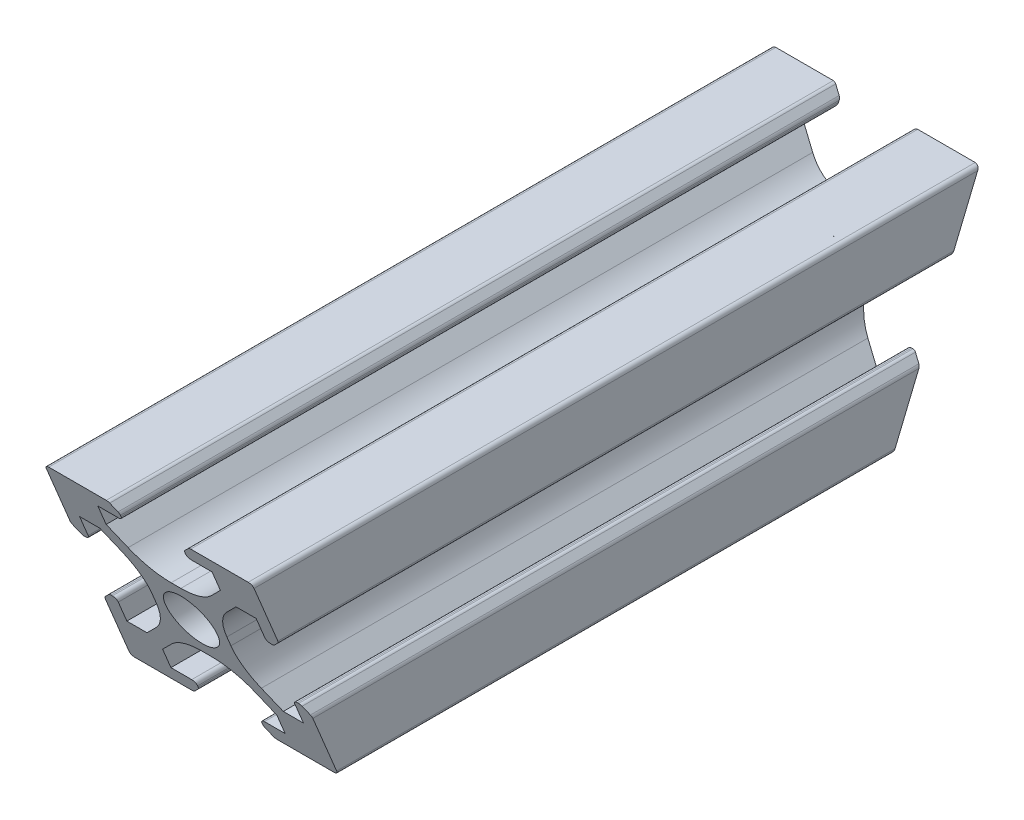
from build123d import *

# Parameters (mm, degrees)
RESSALTO_EXTRUS_O1_DEPTH = 70
PADR_OCIRCULAR1_COUNT    = 4
FILETE1_R                = 0.4
CUT_EXTRUDE1_DEPTH       = 74.484692283
SKETCH4_R                = 1.5
CUT_EXTRUDE3_DEPTH       = 74.484692283


with BuildPart() as part:
    # Esboço1 → Ressalto-extrusão1 (new body)
    with BuildSketch(Plane.XY):
        with BuildLine():
            ThreePointArc((-9.317157288, 3.217157288), (-9.187387948, 3.130448187), (-9.034314575, 3.1))
            Line((-9.034314575, 3.1), (-8.9, 3.1))
            ThreePointArc((-8.9, 3.1), (-8.617157288, 3.217157288), (-8.5, 3.5))
            Line((-8.5, 3.5), (-8.5, 5.5))
            Line((-8.5, 5.5), (-6.560660172, 5.5))
            Line((-6.560660172, 5.5), (-5.064466094, 4.003805922))
            ThreePointArc((-5.064466094, 4.003805922), (-3.980602337, 2.381689178), (-3.6, 0.468272016))
            Line((-3.6, 0.468272016), (-3.6, 0))
            Line((-3.6, 0), (-2.5, 0))
            ThreePointArc((-2.5, 0), (-1.767766953, 1.767766953), (0, 2.5))
            Line((0, 2.5), (0, 3.6))
            Line((0, 3.6), (-0.468272016, 3.6))
            ThreePointArc((-0.468272016, 3.6), (-2.381689178, 3.980602337), (-4.003805922, 5.064466094))
            Line((-4.003805922, 5.064466094), (-5.5, 6.560660172))
            Line((-5.5, 6.560660172), (-5.5, 8.5))
            Line((-5.5, 8.5), (-3.5, 8.5))
            ThreePointArc((-3.5, 8.5), (-3.217157288, 8.617157288), (-3.1, 8.9))
            Line((-3.1, 8.9), (-3.1, 9.034314575))
            ThreePointArc((-3.1, 9.034314575), (-3.130448187, 9.187387948), (-3.217157288, 9.317157288))
            Line((-3.217157288, 9.317157288), (-3.782842712, 9.882842712))
            ThreePointArc((-3.782842712, 9.882842712), (-3.912612052, 9.969551813), (-4.065685425, 10))
            Line((-4.065685425, 10), (-10, 10))
            Line((-10, 10), (-10, 4.065685425))
            ThreePointArc((-10, 4.065685425), (-9.969551813, 3.912612052), (-9.882842712, 3.782842712))
            Line((-9.882842712, 3.782842712), (-9.317157288, 3.217157288))
        make_face()
    ressalto_extrus_o1 = extrude(amount=RESSALTO_EXTRUS_O1_DEPTH)

    # PadrãoCircular1: Ressalto-extrusão1 ×4 about axis
    padr_ocircular1_axis = Axis((0, 0, 0), (0, 0, 1))
    for i in range(1, PADR_OCIRCULAR1_COUNT):
        add(ressalto_extrus_o1.rotate(padr_ocircular1_axis, i * 360 / PADR_OCIRCULAR1_COUNT))

    # Filete1
    filete1_edges = [part.edges().sort_by_distance(p)[0] for p in [
        (-10, -10, 35),
        (-10, 10, 35),
        (10, -10, 35),
        (10, 10, 35),
    ]]
    fillet(filete1_edges, radius=FILETE1_R)

    # Sketch1 → Cut-Extrude1 (cut, through all)
    with BuildSketch(Plane.ZY.offset(10)):
        Polygon((0, 10), (0, -10), (8.284271247, -10), align=None)
        Polygon((70, 10), (61.715728753, -10), (70, -10), align=None)
    extrude(amount=-CUT_EXTRUDE1_DEPTH, mode=Mode.SUBTRACT)

    # Sketch4 → Cut-Extrude3 (cut, through all)
    with BuildSketch(Plane(origin=(10, 0, 0), x_dir=(0, 0, -1), z_dir=(1, 0, 0))):
        with Locations((-11, 0)):
            Circle(SKETCH4_R)
        with Locations((-59, 0)):
            Circle(SKETCH4_R)
    extrude(amount=-CUT_EXTRUDE3_DEPTH, mode=Mode.SUBTRACT)


solid = part.part
